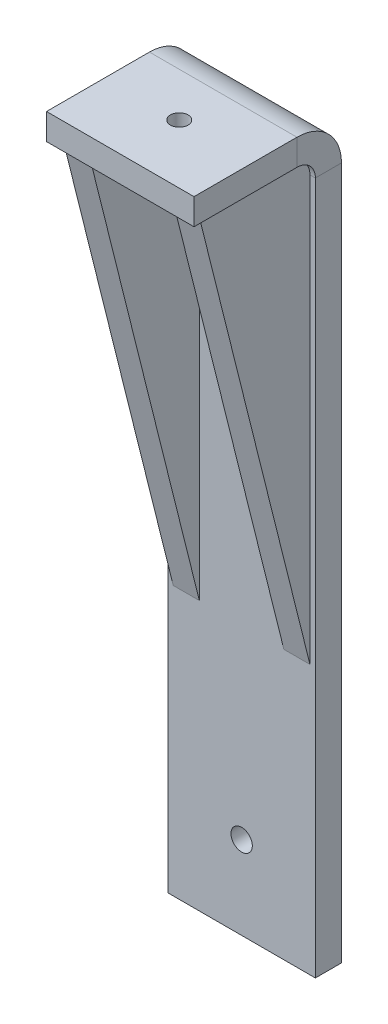
from build123d import *

# Parameters (mm, degrees)
SKETCH2_W                    = 25.4
SKETCH2_H                    = 4.4958
BASE_FLANGE1_DEPTH           = 127
EDGE_FLANGE1_STRIP_W         = 24.3332
EDGE_FLANGE1_STRIP_H         = 4.4958
EDGE_FLANGE1_STRIP_CUT_DEPTH = 25.4
EDGE_FLANGE1_DEPTH           = 25.4
CUT_EXTRUDE1_REACH           = 132.136
SKETCH10_R                   = 1.524
SKETCH11_R                   = 1.8415
CUT_EXTRUDE2_DEPTH           = 130.333969156
BOSS_EXTRUDE1_START          = 9.525
BOSS_EXTRUDE1_DEPTH          = 2.2479


# Sheet-metal steps are written as plain solids
with BuildPart() as part:
    # Sketch2 → Base-Flange1 (new body)
    with BuildSketch(Plane(origin=(0, 0, 0), x_dir=(1, 0, 0), z_dir=(0, 1, 0))):
        with Locations((0, -2.2479)):
            Rectangle(SKETCH2_W, SKETCH2_H)
    extrude(amount=BASE_FLANGE1_DEPTH)

    # Edge-Flange1 strip (across the edge) → Edge-Flange1 strip cut (cut)
    with BuildSketch(Plane(origin=(12.7, 127, 4.4958), x_dir=(0, -1, 0), z_dir=(-1, 0, 0))):
        with Locations((-4.4958, -2.2479)):
            Rectangle(EDGE_FLANGE1_STRIP_W, EDGE_FLANGE1_STRIP_H)
    extrude(amount=EDGE_FLANGE1_STRIP_CUT_DEPTH, mode=Mode.SUBTRACT)

    # Edge-Flange1 section (across the edge) → Edge-Flange1 (add)
    with BuildSketch(Plane(origin=(12.7, 127, 4.4958), x_dir=(0, -1, 0), z_dir=(-1, 0, 0))):
        with BuildLine():
            Line((0, 3.175), (0, 20.9042))
            Line((0, 20.9042), (4.4958, 20.9042))
            Line((4.4958, 20.9042), (4.4958, 3.175))
            ThreePointArc((4.4958, 3.175), (5.42573597, 0.92993597), (7.6708, 0))
            Line((7.6708, 0), (7.6708, -4.4958))
            ThreePointArc((7.6708, -4.4958), (2.246725303, -2.249074697), (0, 3.175))
        make_face()
    extrude(amount=EDGE_FLANGE1_DEPTH)

    # Sketch10 → Cut-Extrude1 (cut, up to next)
    with BuildSketch(Plane(origin=(0, 127, 0), x_dir=(1, 0, 0), z_dir=(0, 1, 0)), mode=Mode.PRIVATE) as cut_extrude1_sk1:
        with Locations(Location((0, -15.24, 0), (0, 0, 270))):
            Circle(SKETCH10_R)
    cut_extrude1_tool1 = extrude(cut_extrude1_sk1.sketch, amount=-CUT_EXTRUDE1_REACH, mode=Mode.PRIVATE) & part.part
    add(cut_extrude1_tool1.solids().sort_by_distance((0, 127, 15.24))[0], mode=Mode.SUBTRACT)

    # Sketch11 → Cut-Extrude2 (cut, through all)
    with BuildSketch(Plane.XY.offset(4.4958)):
        with Locations((0, 14.280866767)):
            Circle(SKETCH11_R)
    extrude(amount=-CUT_EXTRUDE2_DEPTH, mode=Mode.SUBTRACT)


with BuildPart() as body_2:
    # Sketch12 → Boss-Extrude1 (new, symmetric)
    with BuildSketch(Plane(origin=(0, 0, 0), x_dir=(0, 0, -1), z_dir=(1, 0, 0)).offset(BOSS_EXTRUDE1_START)):
        with BuildLine():
            Line((-23.5458, 122.5042), (-4.4958, 46.3042))
            Line((-4.4958, 46.3042), (-4.4958, 119.3292))
            ThreePointArc((-4.4958, 119.3292), (-5.42573597, 121.57426403), (-7.6708, 122.5042))
            Line((-7.6708, 122.5042), (-23.5458, 122.5042))
        make_face()
    extrude(amount=BOSS_EXTRUDE1_DEPTH, both=True)


with BuildPart() as body_3:
    # Mirror2: mirrored copy
    add(body_2.part.mirror(Plane(origin=(0, 0, 0), x_dir=(0, 0, 1), z_dir=(1, 0, 0))))


solid = Compound([part.part, body_2.part, body_3.part])
